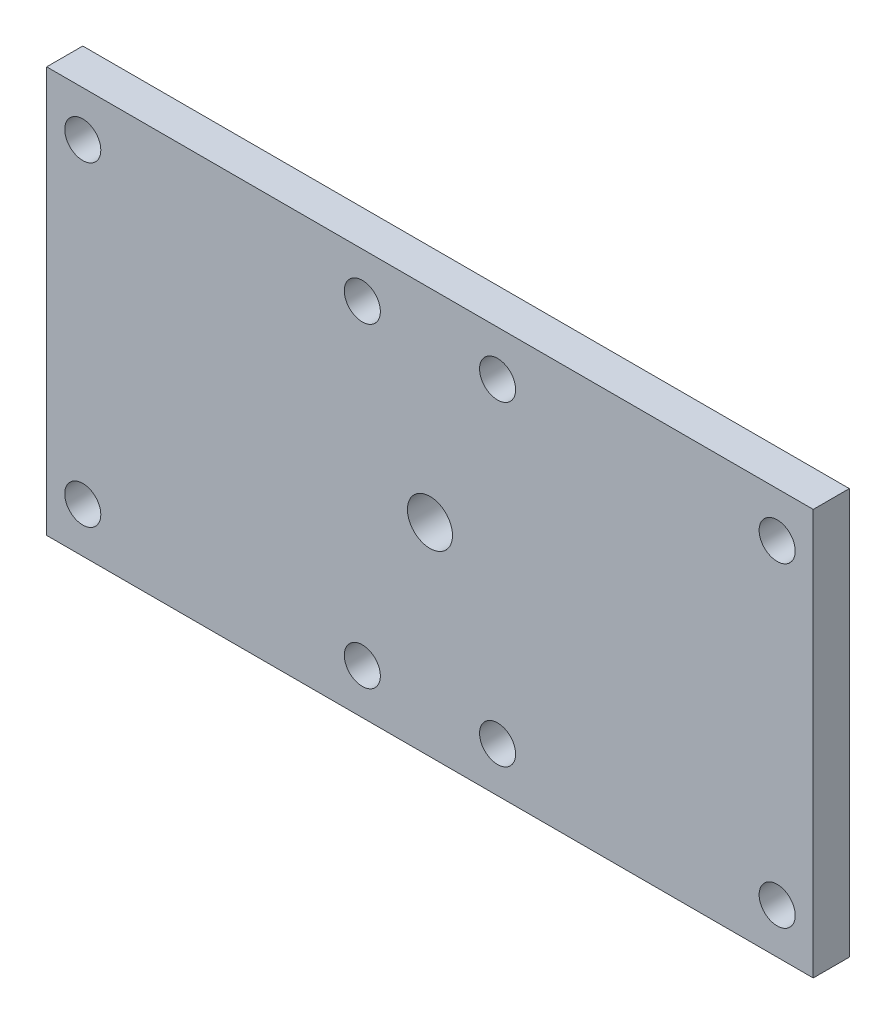
from build123d import *

# Parameters (mm, degrees)
SKETCH1_W                = 85
SKETCH1_H                = 45
BOSS_EXTRUDE1_DEPTH      = 5
CUT_EXTRUDE1_OUTLINE_R   = 2
CUT_EXTRUDE1_OUTLINE_R_2 = 2.5
CUT_EXTRUDE1_DEPTH       = 5
SKETCH3_W                = 85
SKETCH3_H                = 45
CUT_EXTRUDE2_DEPTH       = 1


# Read off the part's stored shape, not the designer's step: Cut-Extrude1
with BuildPart() as part:
    # Sketch1 → Boss-Extrude1 (new body)
    with BuildSketch(Plane.XY):
        with Locations((-42.5, 22.5)):
            Rectangle(SKETCH1_W, SKETCH1_H)
    extrude(amount=BOSS_EXTRUDE1_DEPTH)

    # Cut-Extrude1 outline → Cut-Extrude1 (cut)
    with BuildSketch(Plane.XY):
        with Locations((-81, 40)):
            Circle(CUT_EXTRUDE1_OUTLINE_R)
        with Locations((-35, 5)):
            Circle(CUT_EXTRUDE1_OUTLINE_R)
        with Locations((-35, 40)):
            Circle(CUT_EXTRUDE1_OUTLINE_R)
        with Locations((-4, 40)):
            Circle(CUT_EXTRUDE1_OUTLINE_R)
        with Locations((-42.5, 22.5)):
            Circle(CUT_EXTRUDE1_OUTLINE_R_2)
        with Locations((-81, 5)):
            Circle(CUT_EXTRUDE1_OUTLINE_R)
        with Locations((-50, 5)):
            Circle(CUT_EXTRUDE1_OUTLINE_R)
        with Locations((-50, 40)):
            Circle(CUT_EXTRUDE1_OUTLINE_R)
        with Locations((-4, 5)):
            Circle(CUT_EXTRUDE1_OUTLINE_R)
    extrude(amount=CUT_EXTRUDE1_DEPTH, mode=Mode.SUBTRACT)

    # Sketch3 → Cut-Extrude2 (cut)
    with BuildSketch(Plane.XY.offset(5)):
        with Locations((-42.5, 22.5)):
            Rectangle(SKETCH3_W, SKETCH3_H)
    extrude(amount=-CUT_EXTRUDE2_DEPTH, mode=Mode.SUBTRACT)


solid = part.part
